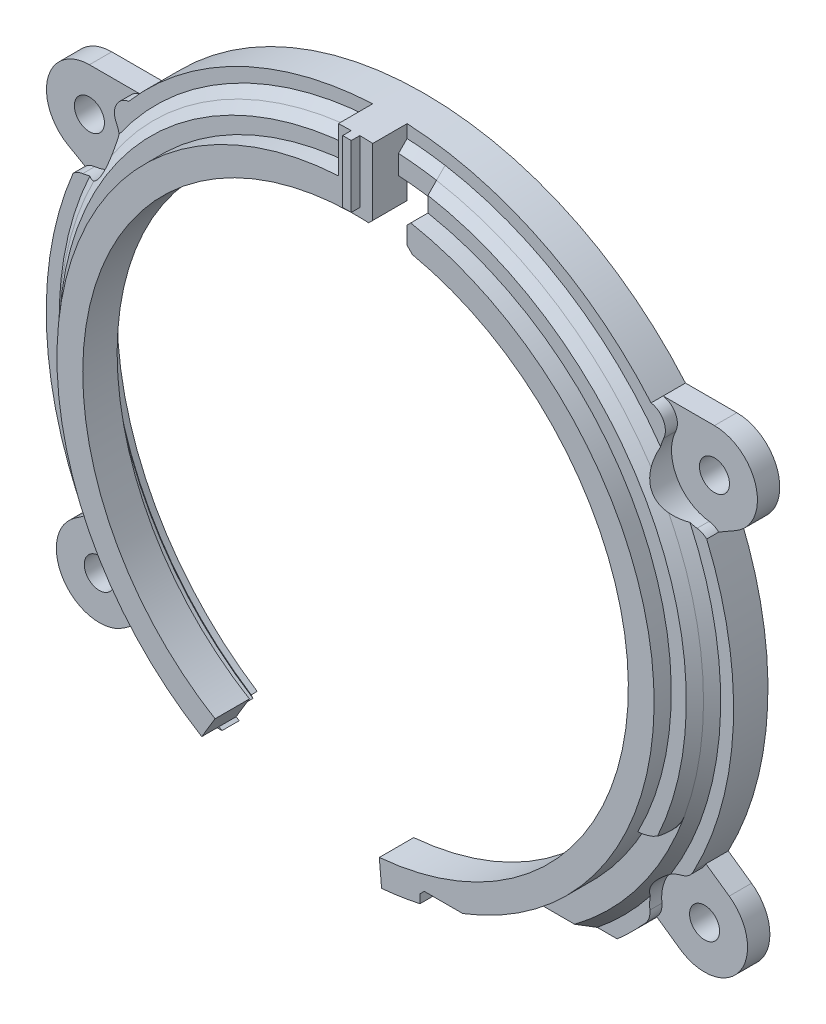
from build123d import *
from build123d.topology import SkipClean

# Parameters (mm, degrees)
SKETCH_1_R           = 40
SKETCH_1_R_2         = 31.75
EXTRUDE_1_DEPTH      = 4
EXTRUDE_START        = -4
SKETCH_2_R           = 1.75
EXTRUDE_2_DEPTH      = 4
CUT_EXTRUDE_2_DEPTH  = 57.867679762
SKETCH_4_R           = 1.75
EXTRUDE_3_DEPTH      = 4
SKETCH_5_R           = 34.75
SKETCH_5_R_2         = 31.75
EXTRUDE_4_DEPTH      = 4
CUT_EXTRUDE_3_DEPTH  = 58.686486022
EXTRUDE_5_DEPTH      = 4
EXTRUDE_6_DEPTH      = 1
CUT_EXTRUDE_START    = -2
CUT_EXTRUDE_4_DEPTH  = 2
CUT_EXTRUDE_START_2  = -1
CUT_EXTRUDE_5_DEPTH  = 1
CHAMFER_1_SIZE       = 1
SKETCH_11_W          = 4.981706152
SKETCH_11_H          = 1.5
CUT_EXTRUDE_6_DEPTH  = 4
CHAMFER_2_SIZE       = 0.5
SKETCH_12_W          = 4
SKETCH_12_H          = 3.514481439
CUT_EXTRUDE_7_DEPTH  = 4
CHAMFER_3_SIZE       = 0.5
SKETCH_13_W          = 1
SKETCH_13_H          = 1
CUT_EXTRUDE_8_DEPTH  = 1
EXTRUDE_7_DEPTH      = 2
SKETCH_14_R          = 35.5
CUT_EXTRUDE_10_DEPTH = 4
SKETCH_16_R          = 35.75
CUT_EXTRUDE_11_DEPTH = 0.7
CHAMFER_4_SIZE       = 0.25
CUT_EXTRUDE_START_3  = 1
CUT_EXTRUDE_12_DEPTH = 57.764441221
FILLET_1_R           = 5
CUT_EXTRUDE_START_4  = -1.4
SKETCH_19_R          = 5
CUT_EXTRUDE_13_DEPTH = 1.4
FILLET_START         = 2.6
FILLET_2_DEPTH       = 1.4
CHAMFER_5_SIZE       = 1
EXTRUDE_9_DEPTH      = 1
CHAMFER_6_SIZE       = 1


with BuildPart() as part:
    # 草图1 → 凸台-拉伸1 (new body)
    with BuildSketch(Plane.XY):
        Circle(SKETCH_1_R)
        Circle(SKETCH_1_R_2, mode=Mode.SUBTRACT)
    extrude(amount=EXTRUDE_1_DEPTH)

    # 草图2 → 凸台-拉伸2 (add)
    # profile 1 of 2: a face of its own
    with BuildSketch(Plane.XY.offset(4).offset(EXTRUDE_START)):
        with BuildLine():
            Line((-38.091420086, -20.568026542), (-35.376971109, -18.667348906))
            ThreePointArc((-35.376971109, -18.667348906), (-32.766081772, -22.943057454), (-29.641206745, -26.858869349))
            Line((-29.641206745, -26.858869349), (-32.355655723, -28.759546985))
            ThreePointArc((-32.355655723, -28.759546985), (-39.319298126, -27.531668945), (-38.091420086, -20.568026542))
        make_face()
        with Locations((-35.223537904, -24.663786763)):
            Circle(SKETCH_2_R, mode=Mode.SUBTRACT)
    # profile 2 of 2: a face of its own
    with BuildSketch(Plane.XY.offset(4).offset(EXTRUDE_START)):
        with BuildLine():
            Line((32.355655723, -28.759546985), (29.641206745, -26.858869349))
            ThreePointArc((29.641206745, -26.858869349), (32.766081772, -22.943057454), (35.376971109, -18.667348906))
            Line((35.376971109, -18.667348906), (38.091420086, -20.568026542))
            ThreePointArc((38.091420086, -20.568026542), (39.319298126, -27.531668945), (32.355655723, -28.759546985))
        make_face()
        with Locations((35.223537904, -24.663786763)):
            Circle(SKETCH_2_R, mode=Mode.SUBTRACT)
    extrude(amount=EXTRUDE_2_DEPTH)

    # 草图3 → 切除-拉伸2 (cut, through all)
    with BuildSketch(Plane.XY.offset(4)):
        with BuildLine():
            Line((-26.457513111, -30), (-18.027756377, -30))
            ThreePointArc((-18.027756377, -30), (0, -35), (18.027756377, -30))
            Line((18.027756377, -30), (26.457513111, -30))
            ThreePointArc((26.457513111, -30), (0, -40), (-26.457513111, -30))
        make_face()
    extrude(amount=-CUT_EXTRUDE_2_DEPTH, mode=Mode.SUBTRACT)

    # 草图4 → 凸台-拉伸3 (add)
    # profile 1 of 2: a face of its own
    with BuildSketch(Plane.XY.offset(4).offset(EXTRUDE_START)):
        with BuildLine():
            Line((-30.397368307, 26), (-36.373066959, 26))
            ThreePointArc((-36.373066959, 26), (-41.20269609, 22.294095226), (-38.873066959, 16.669872981))
            Line((-38.873066959, 16.669872981), (-36.869317712, 15.513007814))
            ThreePointArc((-36.869317712, 15.513007814), (-34.039624165, 21.007236532), (-30.397368307, 26))
        make_face()
        with Locations((-36.373066959, 21)):
            Circle(SKETCH_4_R, mode=Mode.SUBTRACT)
    # profile 2 of 2: a face of its own
    with BuildSketch(Plane.XY.offset(4).offset(EXTRUDE_START)):
        with BuildLine():
            Line((36.373066959, 26), (30.397368307, 26))
            ThreePointArc((30.397368307, 26), (34.039624165, 21.007236532), (36.869317712, 15.513007814))
            Line((36.869317712, 15.513007814), (38.873066959, 16.669872981))
            ThreePointArc((38.873066959, 16.669872981), (41.20269609, 22.294095226), (36.373066959, 26))
        make_face()
        with Locations((36.373066959, 21)):
            Circle(SKETCH_4_R, mode=Mode.SUBTRACT)
    extrude(amount=EXTRUDE_3_DEPTH)

    # 草图5 → 凸台-拉伸4 (add)
    with BuildSketch(Plane(origin=(0, 0, 4), x_dir=(-1, 0, 0), z_dir=(0, 0, -1))):
        Circle(SKETCH_5_R)
        Circle(SKETCH_5_R_2, mode=Mode.SUBTRACT)
    extrude(amount=-EXTRUDE_4_DEPTH)

    # 草图6 → 切除-拉伸3 (cut, through all)
    with SkipClean():  # the faces are left unmerged after this step: merging them gives an invalid solid
        with BuildSketch(Plane.XY.offset(4)):
            with BuildLine():
                Line((-17.898986689, -29.785714286), (-16.353750428, -27.214285714))
                ThreePointArc((-16.353750428, -27.214285714), (-7.142930057, -30.936080072), (2.767194832, -31.629181664))
                Line((2.767194832, -31.629181664), (3.02866206, -34.617765759))
                ThreePointArc((3.02866206, -34.617765759), (-7.817852582, -33.859174252), (-17.898986689, -29.785714286))
            make_face()
        extrude(amount=CUT_EXTRUDE_3_DEPTH, mode=Mode.SUBTRACT)

    # 草图7 → 凸台-拉伸5 (add)
    with SkipClean():  # the faces are left unmerged after this step: merging them gives an invalid solid
        with BuildSketch(Plane.XY.offset(4)):
            with BuildLine():
                Line((-2, 39.949968711), (-2, 34.692398303))
                ThreePointArc((-2, 34.692398303), (0, 34.75), (2, 34.692398303))
                Line((2, 34.692398303), (2, 39.949968711))
                ThreePointArc((2, 39.949968711), (0, 40), (-2, 39.949968711))
            make_face()
        extrude(amount=EXTRUDE_5_DEPTH)

    # 草图8 → 凸台-拉伸6 (add)
    with SkipClean():  # the faces are left unmerged after this step: merging them gives an invalid solid
        with BuildSketch(Plane.XY.offset(8)):
            with BuildLine():
                Line((-0.5, 39.996874878), (-0.5, 31.746062748))
                ThreePointArc((-0.5, 31.746062748), (0, 31.75), (0.5, 31.746062748))
                Line((0.5, 31.746062748), (0.5, 39.996874878))
                ThreePointArc((0.5, 39.996874878), (0, 40), (-0.5, 39.996874878))
            make_face()
        extrude(amount=EXTRUDE_6_DEPTH)

    # 草图9 → 切除-拉伸4 (cut)
    with SkipClean():  # the faces are left unmerged after this step: merging them gives an invalid solid
        with BuildSketch(Plane.XY.offset(4).offset(CUT_EXTRUDE_START)):
            with BuildLine():
                Line((-17.898986689, -29.785714286), (-18.027756377, -30))
                ThreePointArc((-18.027756377, -30), (-7.874096126, -34.102765433), (3.050450996, -34.866814433))
                Line((3.050450996, -34.866814433), (3.02866206, -34.617765759))
                ThreePointArc((3.02866206, -34.617765759), (-7.817852582, -33.859174252), (-17.898986689, -29.785714286))
            make_face()
        extrude(amount=CUT_EXTRUDE_4_DEPTH, mode=Mode.SUBTRACT)

    # 草图10 → 切除-拉伸5 (cut)
    with BuildSketch(Plane.XY.offset(4).offset(CUT_EXTRUDE_START_2)):
        with BuildLine():
            Line((3.02866206, -34.617765759), (2.767194832, -31.629181664))
            ThreePointArc((2.767194832, -31.629181664), (-7.142930057, -30.936080072), (-16.353750428, -27.214285714))
            Line((-16.353750428, -27.214285714), (-17.898986689, -29.785714286))
            ThreePointArc((-17.898986689, -29.785714286), (-7.817852582, -33.859174252), (3.02866206, -34.617765759))
        make_face()
    extrude(amount=CUT_EXTRUDE_5_DEPTH, mode=Mode.SUBTRACT)

    # 倒角1
    # the kernel refuses this chamfer: 1 mm, written as the material it adds along each edge
    with BuildSketch(Plane(origin=(0, 0, 2), x_dir=(0.1605782568970929, -0.987023111893481, 0), z_dir=(0.987023111893481, 0.1605782568970929, 0))) as chamfer_1_piece_1_section:
        Polygon((34.75 + CHAMFER_1_SIZE, 0), (34.75, -CHAMFER_1_SIZE), (34.75, 0), align=None)
    chamfer_1_piece_1 = revolve(axis=Axis((0, 0, 2), (0, 0, -1)), revolution_arc=44.483642938, mode=Mode.PRIVATE)
    chamfer_1_piece_1 = chamfer_1_piece_1 & Plane(origin=(0, 0, 2), x_dir=(-0.5150787536377129, -0.8571428571428571, 0), z_dir=(0, 0, 1)) * Cylinder(35, 143, mode=Mode.PRIVATE)
    add(chamfer_1_piece_1)

    # 草图11 → 切除-拉伸6 (cut)
    with BuildSketch(Plane.XY.offset(8)):
        with Locations((9.990853076, -33.180996154)):
            Rectangle(SKETCH_11_W, SKETCH_11_H)
    extrude(amount=-CUT_EXTRUDE_6_DEPTH, mode=Mode.SUBTRACT)

    # 倒角2
    chamfer_2_edges = [part.edges().sort_by_distance(p)[0] for p in [
        (7.5, -32.430996154, 6),
    ]]
    chamfer(chamfer_2_edges, length=CHAMFER_2_SIZE)

    # 草图12 → 切除-拉伸7 (cut)
    with BuildSketch(Plane.XY.offset(4)):
        with Locations((4, 32.935157584)):
            Rectangle(SKETCH_12_W, SKETCH_12_H)
    extrude(amount=CUT_EXTRUDE_7_DEPTH, mode=Mode.SUBTRACT)

    # 倒角3
    # the kernel refuses this chamfer: 0.630512845, 0.5, 0.471250803, 0.431912073 mm, written as the material it takes off along each edge
    with BuildSketch(Plane(origin=(2, 31.686945261, 9.285841494), x_dir=(0, 1, 0), z_dir=(0, 0, -1))) as chamfer_3_piece_1:
        with BuildLine():
            Line((CHAMFER_3_SIZE, 0), (0.026344876, -0.473655124))
            ThreePointArc((0.026344876, -0.473655124), (0.014426752, -0.243437323), (0, 0))
            Line((0, 0), (CHAMFER_3_SIZE, 0))
        make_face()
    extrude(amount=5.285841494, mode=Mode.SUBTRACT)
    with BuildSketch(Plane(origin=(6, 34.228095185, 9.285841494), x_dir=(0.9838938998328699, -0.17875344436308485, 0), z_dir=(0, 0, -1))) as chamfer_3_piece_2:
        with BuildLine():
            Line((0.430053019, 0), (CHAMFER_3_SIZE * 0.178753444363, CHAMFER_3_SIZE * 0.983893899833))
            Line((CHAMFER_3_SIZE * 0.178753444363, CHAMFER_3_SIZE * 0.983893899833), (0, 0))
            ThreePointArc((0, 0), (0.220718474, -0.000664812), (0.430053019, 0))
        make_face()
    extrude(amount=5.285841494, mode=Mode.SUBTRACT)
    with BuildSketch(Plane(origin=(6, 31.177916864, 4), x_dir=(0, 1, 0), z_dir=(0, 0, 1))) as chamfer_3_piece_3:
        with BuildLine():
            Line((CHAMFER_3_SIZE, 0), (-0.127287982, -0.627287982))
            ThreePointArc((-0.127287982, -0.627287982), (-0.064155933, -0.324269183), (0, 0))
            Line((0, 0), (CHAMFER_3_SIZE, 0))
        make_face()
    extrude(amount=5.653107156, mode=Mode.SUBTRACT)

    # 草图13 → 切除-拉伸8 (cut)
    with BuildSketch(Plane.XY.offset(8)):
        with Locations((0, 32.246062748)):
            Rectangle(SKETCH_13_W, SKETCH_13_H)
    extrude(amount=CUT_EXTRUDE_8_DEPTH, mode=Mode.SUBTRACT)

    # 草图15 → 凸台-拉伸7 (add)
    with BuildSketch(Plane.XY.offset(4)):
        with BuildLine():
            Line((-22.5, -30), (-17.537459907, -30))
            ThreePointArc((-17.537459907, -30), (-33.7891208, 8.115282839), (-2, 34.692398303))
            Line((-2, 34.692398303), (-2, 37.446628687))
            ThreePointArc((-2, 37.446628687), (-18.724578283, 32.490616617), (-31.39767613, 20.504534466))
            ThreePointArc((-31.39767613, 20.504534466), (-32.04293994, 18.5), (-33.456285805, 16.938917915))
            ThreePointArc((-33.456285805, 16.938917915), (-36.518378716, -8.52396715), (-22.5, -30))
        make_face()
        with BuildLine():
            Line((17.537459907, -30), (22.5, -30))
            ThreePointArc((22.5, -30), (36.518378716, -8.52396715), (33.456285805, 16.938917915))
            ThreePointArc((33.456285805, 16.938917915), (32.04293994, 18.5), (31.39767613, 20.504534466))
            ThreePointArc((31.39767613, 20.504534466), (20.619947315, 31.322001417), (6.423126542, 36.945817699))
            Line((6.423126542, 36.945817699), (6.423126542, 34.151221727))
            ThreePointArc((6.423126542, 34.151221727), (34.2399217, 5.932138063), (17.537459907, -30))
        make_face()
    extrude(amount=EXTRUDE_7_DEPTH)

    # 草图14 → 切除-拉伸10 (cut)
    with BuildSketch(Plane(origin=(0, 0, 0), x_dir=(-1, 0, 0), z_dir=(0, 0, -1))):
        Circle(SKETCH_14_R)
    extrude(amount=-CUT_EXTRUDE_10_DEPTH, mode=Mode.SUBTRACT)

    # 草图16 → 切除-拉伸11 (cut)
    with BuildSketch(Plane(origin=(0, 0, 0), x_dir=(-1, 0, 0), z_dir=(0, 0, -1))):
        Circle(SKETCH_16_R)
    extrude(amount=-CUT_EXTRUDE_11_DEPTH, mode=Mode.SUBTRACT)

    # 倒角4
    chamfer_4_edges = [part.edges().sort_by_distance(p)[0] for p in [
        (0, 35.5, 0.7),
    ]]
    chamfer(chamfer_4_edges, length=CHAMFER_4_SIZE - 0.0001)  # a hair under: the kernel refuses the full size

    # 草图17 → 切除-拉伸12 (cut, through all)
    with BuildSketch(Plane.XY.offset(4).offset(CUT_EXTRUDE_START_3)):
        with BuildLine():
            Line((33.915335764, -16), (30.847406698, -16))
            ThreePointArc((30.847406698, -16), (25.184793609, -23.943447348), (17.537459907, -30))
            Line((17.537459907, -30), (22.5, -30))
            ThreePointArc((22.5, -30), (29.063250461, -23.697625886), (33.915335764, -16))
        make_face()
    extrude(amount=CUT_EXTRUDE_12_DEPTH, mode=Mode.SUBTRACT)

    # 圆角1
    # the kernel refuses this fillet: 5 mm, written as the material it takes off along each edge
    with BuildSketch(Plane(origin=(33.915335764, -16, 5), x_dir=(-1, 0, 0), z_dir=(0, 0, 1))) as fillet_1_piece_1:
        with BuildLine():
            CenterArc((3.336067322, -4.992805011), FILLET_1_R, 93.074112765, 67.129236322)
            Line((-1.368435515, -3.299390397), (-1.462525572, -3.265522105))
            ThreePointArc((-1.462525572, -3.265522105), (-0.815894183, -1.595081869), (-0.090440895, 0.042666667))
            Line((-0.090440895, 0.042666667), (0, 0.1))
            ThreePointArc((0, 0.1), (1.533964533, 0.1), (3.062566301, 0.0998561))
            Line((3.062566301, 0.0998561), (3.067929066, 0))
        make_face()
    extrude(amount=9.929793094, mode=Mode.SUBTRACT)

    # 草图19 → 切除-拉伸13 (cut)
    with SkipClean():  # the faces are left unmerged after this step: merging them gives an invalid solid
        with BuildSketch(Plane.XY.offset(4).offset(CUT_EXTRUDE_START_4)):
            with Locations((-36.373066959, 21)):
                Circle(SKETCH_19_R)
            with Locations((-35.223537904, -24.663786763)):
                Circle(SKETCH_19_R)
            with Locations((35.223537904, -24.663786763)):
                Circle(SKETCH_19_R)
            with Locations((36.373066959, 21)):
                Circle(SKETCH_19_R)
        extrude(amount=CUT_EXTRUDE_13_DEPTH, mode=Mode.SUBTRACT)
    add(part.part.scale(1), mode=Mode.REPLACE)  # the faces are merged on a copy

    # 圆角2: read off the stored shape, not the designer's step
    # 圆角2 outline → 圆角2 (cut)
    with SkipClean():  # the faces are left unmerged after this step: merging them gives an invalid solid
        with BuildSketch(Plane.XY.offset(FILLET_START)):
            with BuildLine():
                ThreePointArc((-29.641206745, -26.858869349), (-30.140681237, -26.098853203), (-30.251969164, -25.196237943))
                ThreePointArc((-30.251969164, -25.196237943), (-30.917897357, -27.205726865), (-32.355655723, -28.759546985))
                Line((-32.355655723, -28.759546985), (-29.641206745, -26.858869349))
            make_face()
            with BuildLine():
                ThreePointArc((-38.091420086, -20.568026542), (-36.139564463, -19.748413396), (-34.023501696, -19.809931275))
                ThreePointArc((-34.023501696, -19.809931275), (-34.833619883, -19.396642231), (-35.376971109, -18.667348906))
                Line((-35.376971109, -18.667348906), (-38.091420086, -20.568026542))
            make_face()
            with BuildLine():
                ThreePointArc((35.376971109, -18.667348906), (34.833619883, -19.396642231), (34.023501696, -19.809931275))
                ThreePointArc((34.023501696, -19.809931275), (36.139564463, -19.748413396), (38.091420086, -20.568026542))
                Line((38.091420086, -20.568026542), (35.376971109, -18.667348906))
            make_face()
            with BuildLine():
                ThreePointArc((32.355655723, -28.759546985), (30.917897357, -27.205726865), (30.251969164, -25.196237943))
                ThreePointArc((30.251969164, -25.196237943), (30.140681237, -26.098853203), (29.641206745, -26.858869349))
                Line((29.641206745, -26.858869349), (32.355655723, -28.759546985))
            make_face()
            with BuildLine():
                ThreePointArc((38.873066959, 16.669872981), (37.363128228, 16.099002277), (35.7499931, 16.038974001))
                ThreePointArc((35.7499931, 16.038974001), (36.351331679, 15.86468345), (36.869317712, 15.513007814))
                Line((36.869317712, 15.513007814), (38.873066959, 16.669872981))
            make_face()
            with BuildLine():
                ThreePointArc((30.397368307, 26), (31.838344051, 24.947376668), (31.865176578, 23.163082132))
                ThreePointArc((31.865176578, 23.163082132), (33.709930712, 25.231749677), (36.373066959, 26))
                Line((36.373066959, 26), (30.397368307, 26))
            make_face()
            with BuildLine():
                ThreePointArc((-36.373066959, 26), (-33.709930712, 25.231749677), (-31.865176578, 23.163082132))
                ThreePointArc((-31.865176578, 23.163082132), (-31.838344051, 24.947376668), (-30.397368307, 26))
                Line((-30.397368307, 26), (-36.373066959, 26))
            make_face()
            with BuildLine():
                ThreePointArc((-36.869317712, 15.513007814), (-36.351331679, 15.86468345), (-35.7499931, 16.038974001))
                ThreePointArc((-35.7499931, 16.038974001), (-37.363128228, 16.099002277), (-38.873066959, 16.669872981))
                Line((-38.873066959, 16.669872981), (-36.869317712, 15.513007814))
            make_face()
        extrude(amount=FILLET_2_DEPTH, mode=Mode.SUBTRACT)

    # 倒角5
    # the kernel refuses this chamfer: 1 mm, written as the material it adds along each edge
    with BuildSketch(Plane(origin=(0, 0, 4), x_dir=(-0.8591065787406251, 0.5117967236751112, 0), z_dir=(0.5117967236751112, 0.8591065787406251, 0))) as chamfer_5_piece_1_section:
        Polygon((37.5, CHAMFER_5_SIZE), (37.5 + CHAMFER_5_SIZE, 0), (37.5, 0), align=None)
    chamfer_5_piece_1 = revolve(axis=Axis((0, 0, 4), (0, 0, 1)), revolution_arc=87.844173947, mode=Mode.PRIVATE)
    chamfer_5_piece_1 = split(chamfer_5_piece_1, bisect_by=Plane(origin=(0, -30, 4), z_dir=(0, 1, 0)), keep=Keep.TOP, mode=Mode.PRIVATE)
    chamfer_5_piece_1 = chamfer_5_piece_1 - Plane(origin=(-36.373066959, 21, 4), x_dir=(0.9950781658624842, -0.09909310684277893, 0), z_dir=(0, 0, -1)) * Cylinder(5, 155, mode=Mode.PRIVATE)
    chamfer_5_piece_1 = chamfer_5_piece_1 - Plane(origin=(-35.223537904, -24.663786763, 4), x_dir=(1, 0, 0), z_dir=(0, 0, -1)) * Cylinder(5, 155, mode=Mode.PRIVATE)
    with BuildSketch(Plane(origin=(0, 0, 4), x_dir=(0.015228815429467265, 0.9998840348663515, 0), z_dir=(0.9998840348663515, -0.015228815429467265, 0))) as chamfer_5_piece_2_section:
        Polygon((37.5 + CHAMFER_5_SIZE, 0), (37.5, CHAMFER_5_SIZE), (37.5, 0), align=None)
    chamfer_5_piece_2 = revolve(axis=Axis((0, 0, 4), (0, 0, 1)), revolution_arc=61.655480758, mode=Mode.PRIVATE)
    chamfer_5_piece_2 = chamfer_5_piece_2 - Plane(origin=(-36.373066959, 21, 4), x_dir=(0.9950781658624842, -0.09909310684277893, 0), z_dir=(0, 0, -1)) * Cylinder(5, 154, mode=Mode.PRIVATE)
    with BuildSketch(Plane(origin=(0, 0, 4), x_dir=(0.5437518250984329, -0.8392460620712637, 0), z_dir=(-0.8392460620712637, -0.5437518250984329, 0))) as chamfer_5_piece_3_section:
        Polygon((37.5 + CHAMFER_5_SIZE, 0), (37.5, CHAMFER_5_SIZE), (37.5, 0), align=None)
    chamfer_5_piece_3 = revolve(axis=Axis((0, 0, 4), (0, 0, 1)), revolution_arc=87.844173947, mode=Mode.PRIVATE)
    chamfer_5_piece_3 = split(chamfer_5_piece_3, bisect_by=Plane(origin=(0, -30, 4), z_dir=(0, 1, 0)), keep=Keep.TOP, mode=Mode.PRIVATE)
    chamfer_5_piece_3 = chamfer_5_piece_3 - Plane(origin=(36.373066959, 21, 4), x_dir=(1, 0, 0), z_dir=(0, 0, -1)) * Cylinder(5, 155, mode=Mode.PRIVATE)
    chamfer_5_piece_3 = chamfer_5_piece_3 - Plane(origin=(35.223537904, -24.663786763, 4), x_dir=(1, 0, 0), z_dir=(0, 0, -1)) * Cylinder(5, 155, mode=Mode.PRIVATE)
    with BuildSketch(Plane(origin=(0, 0, 4), x_dir=(0.8727752990401667, 0.4881221951369837, 0), z_dir=(0.4881221951369837, -0.8727752990401667, 0))) as chamfer_5_piece_4_section:
        Polygon((37.5 + CHAMFER_5_SIZE, 0), (37.5, CHAMFER_5_SIZE), (37.5, 0), align=None)
    chamfer_5_piece_4 = revolve(axis=Axis((0, 0, 4), (0, 0, 1)), revolution_arc=54.849993371, mode=Mode.PRIVATE)
    chamfer_5_piece_4 = chamfer_5_piece_4 - Plane(origin=(36.373066959, 21, 4), x_dir=(1, 0, 0), z_dir=(0, 0, -1)) * Cylinder(5, 154, mode=Mode.PRIVATE)
    chamfer_5_piece_4 = split(chamfer_5_piece_4, bisect_by=Plane(origin=(6.423126542, 0, 4), z_dir=(1, 0, 0)), keep=Keep.TOP, mode=Mode.PRIVATE)
    add([chamfer_5_piece_1, chamfer_5_piece_2, chamfer_5_piece_3, chamfer_5_piece_4])
    # the kernel refuses this chamfer: 1 mm, written as the material it takes off along each edge
    with BuildSketch(Plane(origin=(0, 0, 6), x_dir=(-0.8591065787406251, 0.5117967236751112, 0), z_dir=(0.5117967236751112, 0.8591065787406251, 0))) as chamfer_5_2_piece_1:
        Polygon((37.5, -CHAMFER_5_SIZE), (37.5 - CHAMFER_5_SIZE, 0), (37.5, 0), align=None)
    chamfer_5_2_piece_1_solid = revolve(axis=Axis((0, 0, 6), (0, 0, 1)), revolution_arc=87.844173947, mode=Mode.PRIVATE)
    with BuildSketch(Plane(origin=(0, 0, 6), x_dir=(0.0152288154294671, 0.9998840348663515, 0), z_dir=(0.9998840348663515, -0.0152288154294671, 0))) as chamfer_5_2_piece_2_section:
        Polygon((37.5, -CHAMFER_5_SIZE), (37.5 - CHAMFER_5_SIZE, 0), (37.5, 0), align=None)
    chamfer_5_2_piece_2 = revolve(axis=Axis((0, 0, 6), (0, 0, 1)), revolution_arc=61.655480758, mode=Mode.PRIVATE)
    chamfer_5_2_piece_2 = split(chamfer_5_2_piece_2, bisect_by=Plane(origin=(-2, 0, 6), z_dir=(-1, 0, 0)), keep=Keep.TOP, mode=Mode.PRIVATE)
    with BuildSketch(Plane(origin=(0, 0, 6), x_dir=(0.8727752990401667, 0.4881221951369837, 0), z_dir=(0.4881221951369837, -0.8727752990401667, 0))) as chamfer_5_2_piece_3:
        Polygon((37.5, -CHAMFER_5_SIZE), (37.5 - CHAMFER_5_SIZE, 0), (37.5, 0), align=None)
    chamfer_5_2_piece_3_solid = revolve(axis=Axis((0, 0, 6), (0, 0, 1)), revolution_arc=54.849993371, mode=Mode.PRIVATE)
    with BuildSketch(Plane(origin=(0, 0, 6), x_dir=(0.8951127560494672, -0.4458398299361859, 0), z_dir=(-0.4458398299361859, -0.8951127560494672, 0))) as chamfer_5_2_piece_4:
        Polygon((37.5 - CHAMFER_5_SIZE, 0), (37.5, -CHAMFER_5_SIZE), (37.5, 0), align=None)
    chamfer_5_2_piece_4_solid = revolve(axis=Axis((0, 0, 6), (0, 0, 1)), revolution_arc=57.259843687, mode=Mode.PRIVATE)
    add([chamfer_5_2_piece_1_solid, chamfer_5_2_piece_2, chamfer_5_2_piece_3_solid, chamfer_5_2_piece_4_solid], mode=Mode.SUBTRACT)

    # 草图20 → 凸台-拉伸9 (add)
    with SkipClean():  # the faces are left unmerged after this step: merging them gives an invalid solid
        with BuildSketch(Plane.XY.offset(4)):
            with BuildLine():
                Line((2, 34.199187195), (2, 38.448016854))
                ThreePointArc((2, 38.448016854), (4.218613871, 38.268176035), (6.423126542, 37.960419458))
                Line((6.423126542, 37.960419458), (6.423126542, 34.151221727))
                Line((6.423126542, 34.151221727), (6, 33.728095185))
                ThreePointArc((6, 33.728095185), (4.006929238, 34.022476731), (2, 34.199187195))
            make_face()
        extrude(amount=EXTRUDE_9_DEPTH)

    # 倒角6
    # the kernel refuses this chamfer: 1 mm, written as the material it takes off along each edge
    with BuildSketch(Plane(origin=(0, 0, 5), x_dir=(-0.014825118151486493, 0.9998901018971007, 0), z_dir=(-0.9998901018971007, -0.014825118151486493, 0))) as chamfer_6_piece_1_section:
        Polygon((38.5 - CHAMFER_6_SIZE, 0), (38.5, CHAMFER_6_SIZE), (38.5, 0), align=None)
    chamfer_6_piece_1 = revolve(axis=Axis((0, 0, 5), (0, 0, -1)), revolution_arc=14.28045842, mode=Mode.PRIVATE)
    chamfer_6_piece_1 = split(chamfer_6_piece_1, bisect_by=Plane(origin=(2, 0, 5), z_dir=(1, 0, 0)), keep=Keep.TOP, mode=Mode.PRIVATE)
    chamfer_6_piece_1 = split(chamfer_6_piece_1, bisect_by=Plane(origin=(0, 0, 4), z_dir=(0, 0, 1)), keep=Keep.TOP, mode=Mode.PRIVATE)
    add(chamfer_6_piece_1, mode=Mode.SUBTRACT)
    with BuildSketch(Plane(origin=(0, 0, 5), x_dir=(0.2484896158959109, 0.968634559982196, 0), z_dir=(0.968634559982196, -0.2484896158959109, 0))) as chamfer_6_piece_2_section:
        Polygon((34.257618201, -CHAMFER_6_SIZE), (34.257618201 + CHAMFER_6_SIZE, 0), (34.257618201, 0), align=None)
    chamfer_6_piece_2 = revolve(axis=Axis((0, 0, 5), (0, 0, 1)), revolution_arc=15.342398379, mode=Mode.PRIVATE)
    chamfer_6_piece_2 = split(chamfer_6_piece_2, bisect_by=Plane(origin=(6, 0, 5), z_dir=(1, 0, 0)), keep=Keep.TOP, mode=Mode.PRIVATE)
    chamfer_6_piece_2 = split(chamfer_6_piece_2, bisect_by=Plane(origin=(6.423126542, 0, 5), z_dir=(-1, 0, 0)), keep=Keep.TOP, mode=Mode.PRIVATE)
    chamfer_6_piece_2 = split(chamfer_6_piece_2, bisect_by=Plane(origin=(-13.864047593, 13.864047593, 5), z_dir=(-0.7071067811863215, 0.7071067811867735, 0)), keep=Keep.TOP, mode=Mode.PRIVATE)
    add(chamfer_6_piece_2, mode=Mode.SUBTRACT)
    with BuildSketch(Plane(origin=(0, 0, 5), x_dir=(0.2484896158959109, 0.968634559982196, 0), z_dir=(0.968634559982196, -0.2484896158959109, 0))) as chamfer_6_piece_3_section:
        Polygon((34.257618201, -CHAMFER_6_SIZE), (34.257618201 + CHAMFER_6_SIZE, 0), (34.257618201, 0), align=None)
    chamfer_6_piece_3 = revolve(axis=Axis((0, 0, 5), (0, 0, 1)), revolution_arc=15.342398379, mode=Mode.PRIVATE)
    chamfer_6_piece_3 = split(chamfer_6_piece_3, bisect_by=Plane(origin=(2, 0, 5), z_dir=(1, 0, 0)), keep=Keep.TOP, mode=Mode.PRIVATE)
    chamfer_6_piece_3 = split(chamfer_6_piece_3, bisect_by=Plane(origin=(6, 0, 5), z_dir=(-1, 0, 0)), keep=Keep.TOP, mode=Mode.PRIVATE)
    chamfer_6_piece_3 = split(chamfer_6_piece_3, bisect_by=Plane(origin=(-13.864047593, 13.864047593, 5), z_dir=(-0.7071067811863215, 0.7071067811867735, 0)), keep=Keep.TOP, mode=Mode.PRIVATE)
    add(chamfer_6_piece_3, mode=Mode.SUBTRACT)


solid = part.part
